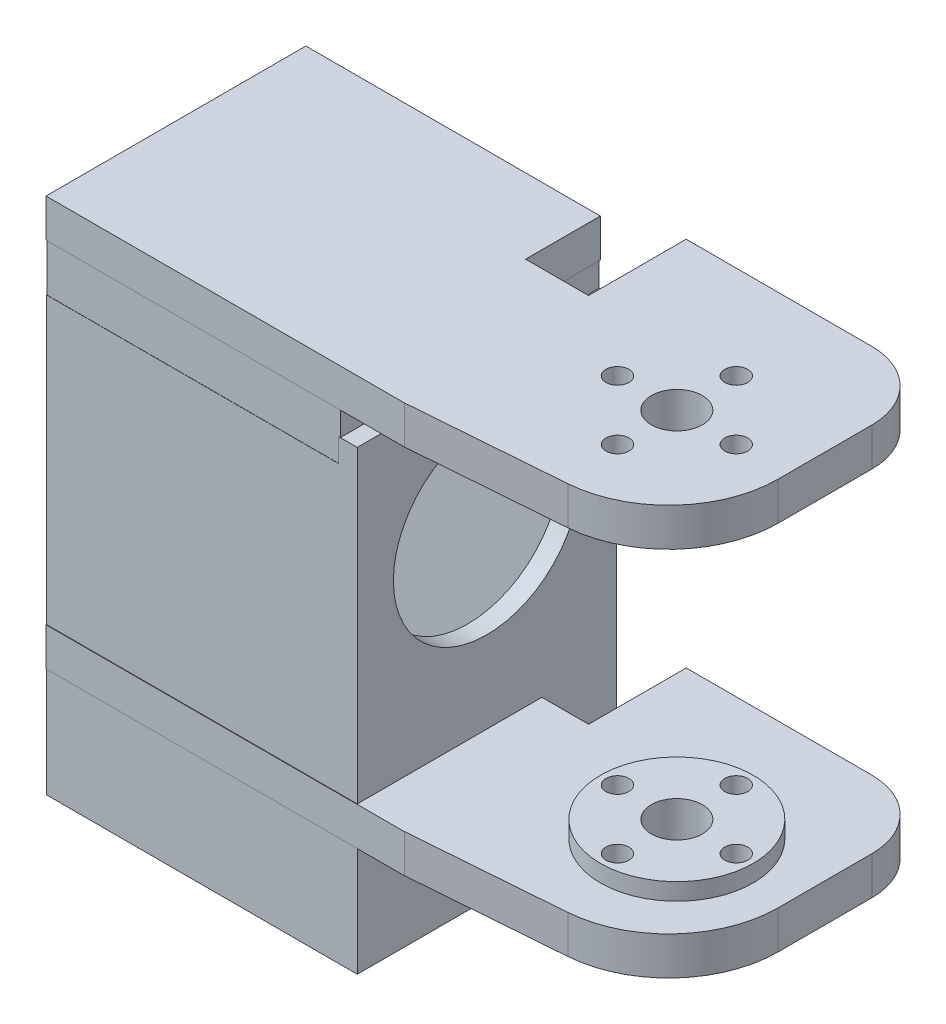
from build123d import *

# Parameters (mm, degrees)
BOSS_1_DEPTH  = 4.5
S_CYL2_R      = 9
BOSS_2_DEPTH  = 2
BOSS_3_DEPTH  = 4.5
S_PRISM4_W    = 7.775
S_PRISM4_H    = 21.81
BOSS_4_DEPTH  = 4.5
S_PRISM5_W    = 42.225
S_PRISM5_H    = 2.6
BOSS_5_DEPTH  = 4.5
S_PRISM6_W    = 34.7
S_PRISM6_H    = 30.62
BOSS_6_DEPTH  = 4.5
S_PRISM7_W    = 7.775
S_PRISM7_H    = 21.81
BOSS_7_DEPTH  = 4.5
S_PRISM8_W    = 42.225
S_PRISM8_H    = 2.6
BOSS_8_DEPTH  = 4.5
S_BOX9_W      = 34.4
S_BOX9_H      = 2.5
BOSS_9_DEPTH  = 30.52
S_BOX10_W     = 34.4
S_BOX10_H     = 51.02
BOSS_10_DEPTH = 2.5
S_BOX11_W     = 34.4
S_BOX11_H     = 51.02
BOSS_11_DEPTH = 2.5
S_BOX12_W     = 2.4
S_BOX12_H     = 51.02
BOSS_12_DEPTH = 30.52
S_BOX13_W     = 2.225
S_BOX13_H     = 53.77
BOSS_13_DEPTH = 30.52
S_BOX14_W     = 34.56
S_BOX14_H     = 5.825
BOSS_14_DEPTH = 30.48
S_HOLE15_R    = 3
HOLE_15_DEPTH = 4.7
S_HOLE16_R    = 1.35
HOLE_16_DEPTH = 4.7
S_HOLE17_R    = 1.35
HOLE_17_DEPTH = 4.7
S_HOLE18_R    = 1.35
HOLE_18_DEPTH = 4.7
S_HOLE19_R    = 1.35
HOLE_19_DEPTH = 4.7
S_HOLE20_R    = 3
HOLE_20_DEPTH = 6.7
S_HOLE21_R    = 1.35
HOLE_21_DEPTH = 6.7
S_HOLE22_R    = 1.35
HOLE_22_DEPTH = 6.7
S_HOLE23_R    = 1.35
HOLE_23_DEPTH = 6.7
S_HOLE24_R    = 1.35
HOLE_24_DEPTH = 6.7
S_HOLE25_R    = 11
HOLE_25_DEPTH = 2.6
S_HOLE26_R    = 1.1
HOLE_26_DEPTH = 2.6
S_HOLE27_R    = 1.1
HOLE_27_DEPTH = 2.6
S_HOLE28_R    = 1.1
HOLE_28_DEPTH = 2.6
S_HOLE29_R    = 11
HOLE_29_DEPTH = 2.425
CUT_30_DEPTH  = 34.6


with BuildPart() as part:
    # S_prism1 → Boss_1 (new body)
    with BuildSketch(Plane(origin=(0, 18.625, 0), x_dir=(1, 0, 0), z_dir=(0, 1, 0))):
        with BuildLine():
            Line((13, 10), (13, -1.0582))
            ThreePointArc((13, -1.0582), (9.566483076, -9.821518282), (1.0937, -13.9199))
            Line((1.0937, -13.9199), (-16.9, -15.31))
            Line((-16.9, -15.31), (-16.9, 18))
            Line((-16.9, 18), (5, 18))
            ThreePointArc((5, 18), (10.6569, 15.6569), (13, 10))
        make_face()
    extrude(amount=BOSS_1_DEPTH)

    # S_prism4 → Boss_4 (add)
    with BuildSketch(Plane(origin=(0, 18.625, 0), x_dir=(1, 0, 0), z_dir=(0, 1, 0))):
        with Locations((-20.6875, -4.405)):
            Rectangle(S_PRISM4_W, S_PRISM4_H)
    extrude(amount=BOSS_4_DEPTH)

    # S_prism5 → Boss_5 (add)
    with BuildSketch(Plane(origin=(0, 18.625, 0), x_dir=(1, 0, 0), z_dir=(0, 1, 0))):
        with Locations((-37.9125, -14.01)):
            Rectangle(S_PRISM5_W, S_PRISM5_H)
    extrude(amount=BOSS_5_DEPTH)

    # S_prism6 → Boss_6 (add)
    with BuildSketch(Plane(origin=(0, 18.625, 0), x_dir=(1, 0, 0), z_dir=(0, 1, 0))):
        with Locations((-41.675, 0)):
            Rectangle(S_PRISM6_W, S_PRISM6_H)
    extrude(amount=BOSS_6_DEPTH)



with BuildPart() as body_2:
    # S_cyl2 → Boss_2 (new body)
    with BuildSketch(Plane(origin=(0, -20.625, 0), x_dir=(1, 0, 0), z_dir=(0, 1, 0))):
        Circle(S_CYL2_R)
    extrude(amount=BOSS_2_DEPTH)

    # S_prism3 → Boss_3 (add)
    with BuildSketch(Plane(origin=(0, -25.125, 0), x_dir=(1, 0, 0), z_dir=(0, 1, 0))):
        with BuildLine():
            Line((13, 10), (13, -1.0582))
            ThreePointArc((13, -1.0582), (9.566483076, -9.821518282), (1.0937, -13.9199))
            Line((1.0937, -13.9199), (-16.9, -15.31))
            Line((-16.9, -15.31), (-16.9, 18))
            Line((-16.9, 18), (5, 18))
            ThreePointArc((5, 18), (10.6569, 15.6569), (13, 10))
        make_face()
    extrude(amount=BOSS_3_DEPTH)

    # S_prism7 → Boss_7 (add)
    with BuildSketch(Plane(origin=(0, -25.125, 0), x_dir=(1, 0, 0), z_dir=(0, 1, 0))):
        with Locations((-20.6875, -4.405)):
            Rectangle(S_PRISM7_W, S_PRISM7_H)
    extrude(amount=BOSS_7_DEPTH)

    # S_prism8 → Boss_8 (add)
    with BuildSketch(Plane(origin=(0, -25.125, 0), x_dir=(1, 0, 0), z_dir=(0, 1, 0))):
        with Locations((-37.9125, -14.01)):
            Rectangle(S_PRISM8_W, S_PRISM8_H)
    extrude(amount=BOSS_8_DEPTH)



with BuildPart() as body_3:
    # S_box9 → Boss_9 (new body)
    with BuildSketch(Plane.XY.offset(-15.26)):
        with Locations((-41.825, 11.76)):
            Rectangle(S_BOX9_W, S_BOX9_H)
    extrude(amount=BOSS_9_DEPTH)

    # S_box10 → Boss_10 (add)
    with BuildSketch(Plane.XY.offset(-15.26)):
        with Locations((-41.825, -12.5)):
            Rectangle(S_BOX10_W, S_BOX10_H)
    extrude(amount=BOSS_10_DEPTH)


with BuildPart() as body_2_1:
    add(body_2.part)

    add(body_3.part)  # Boss_11 merges body 3
    # S_box11 → Boss_11 (add)
    with BuildSketch(Plane.XY.offset(12.76)):
        with Locations((-41.825, -12.5)):
            Rectangle(S_BOX11_W, S_BOX11_H)
    extrude(amount=BOSS_11_DEPTH)

    # S_box12 → Boss_12 (add)
    with BuildSketch(Plane.XY.offset(-15.26)):
        with Locations((-57.825, -12.5)):
            Rectangle(S_BOX12_W, S_BOX12_H)
    extrude(amount=BOSS_12_DEPTH)

    # S_box13 → Boss_13 (add)
    with BuildSketch(Plane.XY.offset(-15.26)):
        with Locations((-23.5125, -11.125)):
            Rectangle(S_BOX13_W, S_BOX13_H)
    extrude(amount=BOSS_13_DEPTH)


with BuildPart() as part_1:
    add(part.part)

    add(body_2_1.part)  # Boss_14 merges body 2
    # S_box14 → Boss_14 (add)
    with BuildSketch(Plane.XY.offset(-15.24)):
        with Locations((-41.675, 15.8125)):
            Rectangle(S_BOX14_W, S_BOX14_H)
    extrude(amount=BOSS_14_DEPTH)

    # S_hole15 → Hole_15 (cut)
    with BuildSketch(Plane(origin=(0, 18.525, 0), x_dir=(1, 0, 0), z_dir=(0, 1, 0))):
        Circle(S_HOLE15_R)
    extrude(amount=HOLE_15_DEPTH, mode=Mode.SUBTRACT)

    # S_hole16 → Hole_16 (cut)
    with BuildSketch(Plane(origin=(0, 18.525, 0), x_dir=(1, 0, 0), z_dir=(0, 1, 0))):
        with Locations((7, 0)):
            Circle(S_HOLE16_R)
    extrude(amount=HOLE_16_DEPTH, mode=Mode.SUBTRACT)

    # S_hole17 → Hole_17 (cut)
    with BuildSketch(Plane(origin=(0, 18.525, 0), x_dir=(1, 0, 0), z_dir=(0, 1, 0))):
        with Locations((0, -7)):
            Circle(S_HOLE17_R)
    extrude(amount=HOLE_17_DEPTH, mode=Mode.SUBTRACT)

    # S_hole18 → Hole_18 (cut)
    with BuildSketch(Plane(origin=(0, 18.525, 0), x_dir=(1, 0, 0), z_dir=(0, 1, 0))):
        with Locations((-7, 0)):
            Circle(S_HOLE18_R)
    extrude(amount=HOLE_18_DEPTH, mode=Mode.SUBTRACT)

    # S_hole19 → Hole_19 (cut)
    with BuildSketch(Plane(origin=(0, 18.525, 0), x_dir=(1, 0, 0), z_dir=(0, 1, 0))):
        with Locations((0, 7)):
            Circle(S_HOLE19_R)
    extrude(amount=HOLE_19_DEPTH, mode=Mode.SUBTRACT)

    # S_hole20 → Hole_20 (cut)
    with BuildSketch(Plane(origin=(0, -25.225, 0), x_dir=(1, 0, 0), z_dir=(0, 1, 0))):
        Circle(S_HOLE20_R)
    extrude(amount=HOLE_20_DEPTH, mode=Mode.SUBTRACT)

    # S_hole21 → Hole_21 (cut)
    with BuildSketch(Plane(origin=(0, -25.225, 0), x_dir=(1, 0, 0), z_dir=(0, 1, 0))):
        with Locations((7, 0)):
            Circle(S_HOLE21_R)
    extrude(amount=HOLE_21_DEPTH, mode=Mode.SUBTRACT)

    # S_hole22 → Hole_22 (cut)
    with BuildSketch(Plane(origin=(0, -25.225, 0), x_dir=(1, 0, 0), z_dir=(0, 1, 0))):
        with Locations((0, -7)):
            Circle(S_HOLE22_R)
    extrude(amount=HOLE_22_DEPTH, mode=Mode.SUBTRACT)

    # S_hole23 → Hole_23 (cut)
    with BuildSketch(Plane(origin=(0, -25.225, 0), x_dir=(1, 0, 0), z_dir=(0, 1, 0))):
        with Locations((-7, 0)):
            Circle(S_HOLE23_R)
    extrude(amount=HOLE_23_DEPTH, mode=Mode.SUBTRACT)

    # S_hole24 → Hole_24 (cut)
    with BuildSketch(Plane(origin=(0, -25.225, 0), x_dir=(1, 0, 0), z_dir=(0, 1, 0))):
        with Locations((0, 7)):
            Circle(S_HOLE24_R)
    extrude(amount=HOLE_24_DEPTH, mode=Mode.SUBTRACT)

    # S_hole25 → Hole_25 (cut)
    with BuildSketch(Plane(origin=(-59.125, 0, 0), x_dir=(0, 0, -1), z_dir=(1, 0, 0))):
        Circle(S_HOLE25_R)
    extrude(amount=HOLE_25_DEPTH, mode=Mode.SUBTRACT)

    # S_hole26 → Hole_26 (cut)
    with BuildSketch(Plane(origin=(-59.125, 0, 0), x_dir=(0, 0, -1), z_dir=(1, 0, 0))):
        with Locations((-10.25, -8.3)):
            Circle(S_HOLE26_R)
    extrude(amount=HOLE_26_DEPTH, mode=Mode.SUBTRACT)

    # S_hole27 → Hole_27 (cut)
    with BuildSketch(Plane(origin=(-59.125, 0, 0), x_dir=(0, 0, -1), z_dir=(1, 0, 0))):
        with Locations((10.25, -32.75)):
            Circle(S_HOLE27_R)
    extrude(amount=HOLE_27_DEPTH, mode=Mode.SUBTRACT)

    # S_hole28 → Hole_28 (cut)
    with BuildSketch(Plane(origin=(-59.125, 0, 0), x_dir=(0, 0, -1), z_dir=(1, 0, 0))):
        with Locations((-10.25, -32.75)):
            Circle(S_HOLE28_R)
    extrude(amount=HOLE_28_DEPTH, mode=Mode.SUBTRACT)

    # S_hole29 → Hole_29 (cut)
    with BuildSketch(Plane(origin=(-24.725, 0, 0), x_dir=(0, 0, -1), z_dir=(1, 0, 0))):
        Circle(S_HOLE29_R)
    extrude(amount=HOLE_29_DEPTH, mode=Mode.SUBTRACT)

    # S_pcut30 → Cut_30 (cut)
    with BuildSketch(Plane(origin=(-59.125, 0, 0), x_dir=(0, 0, -1), z_dir=(1, 0, 0))):
        Polygon((15.86, -38.61), (15.86, -28.41), (5.66, -38.61), align=None)
    extrude(amount=CUT_30_DEPTH, mode=Mode.SUBTRACT)


solid = part_1.part
